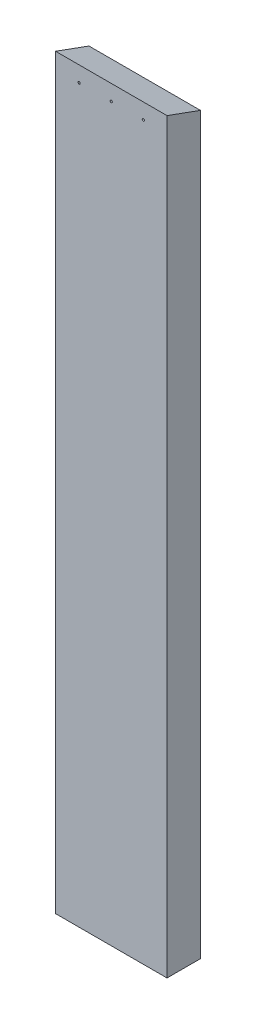
from build123d import *

# Parameters (mm, degrees)
SKETCH2_W               = 63.5
SKETCH2_H               = 19.05
BOSS_EXTRUDE1_DEPTH     = 425.45
CUT_EXTRUDE1_DEPTH      = 431.584318107
CUT_EXTRUDE1_DEPTH_BACK = 50.8
SKETCH3_R               = 0.635
SKETCH4_R               = 0.635
CUT_EXTRUDE2_DEPTH      = 431.584318107
CUT_EXTRUDE3_DEPTH      = 431.584318107


with BuildPart() as part:
    # Sketch2 → Boss-Extrude1 (new body)
    with BuildSketch(Plane(origin=(0, 0, 0), x_dir=(1, 0, 0), z_dir=(0, 1, 0))):
        with Locations((31.75, 9.525)):
            Rectangle(SKETCH2_W, SKETCH2_H)
    extrude(amount=BOSS_EXTRUDE1_DEPTH)

    # Sketch3 → Cut-Extrude1 (cut, two sides: drawn at the far end of the back side and taken through both)
    with BuildSketch(Plane.XZ.offset(-CUT_EXTRUDE1_DEPTH_BACK)):
        with Locations((13.487400071, -9.524999694)):
            Circle(SKETCH3_R)
        with Locations((31.750000071, -9.524999694)):
            Circle(SKETCH3_R)
        with Locations((50.012600071, -9.524999694)):
            Circle(SKETCH3_R)
    extrude(amount=CUT_EXTRUDE1_DEPTH + CUT_EXTRUDE1_DEPTH_BACK, mode=Mode.SUBTRACT)

    # Sketch4 → Cut-Extrude2 (cut, through all)
    with BuildSketch(Plane.XY):
        with Locations((31.724600071, 416.56)):
            Circle(SKETCH4_R)
        with Locations((50.012600071, 416.56)):
            Circle(SKETCH4_R)
        with Locations((13.436600071, 416.56)):
            Circle(SKETCH4_R)
    extrude(amount=-CUT_EXTRUDE2_DEPTH, mode=Mode.SUBTRACT)

    # Sketch5 → Cut-Extrude3 (cut, through all)
    with BuildSketch(Plane.ZY):
        Polygon((0, 425.45), (-19.05, 418.516367037), (-19.05, 425.45), align=None)
    extrude(amount=-CUT_EXTRUDE3_DEPTH, mode=Mode.SUBTRACT)


solid = part.part
